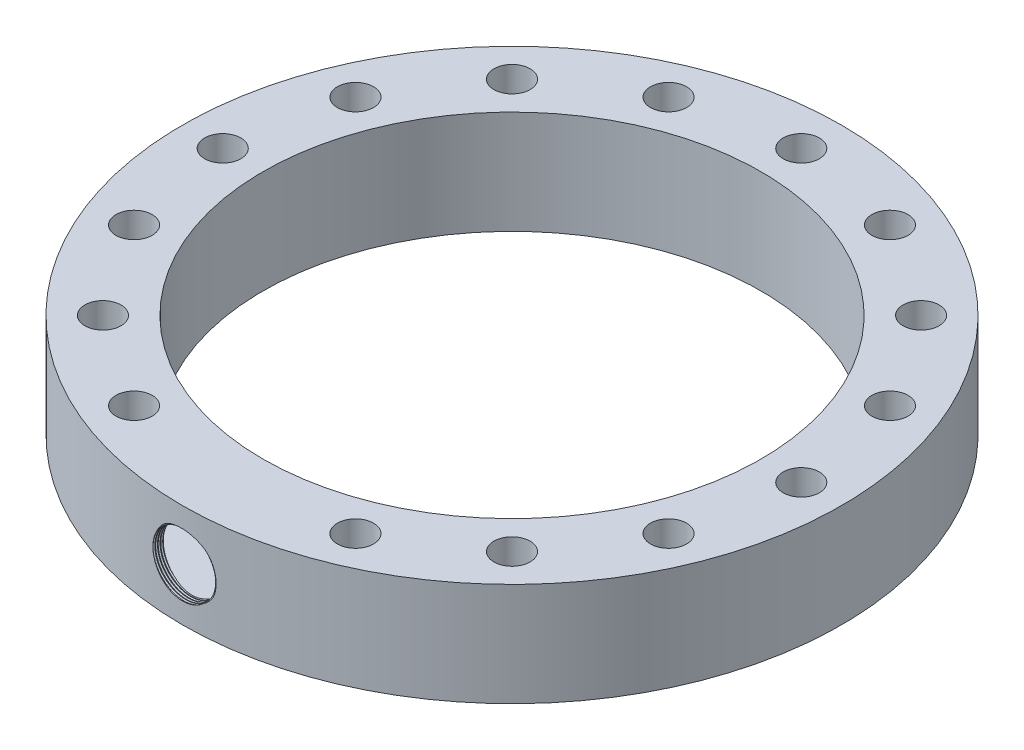
from build123d import *

# Parameters (mm, degrees)
SKETCH2_R           = 31.9
SKETCH2_R_2         = 24.1
BOSS_EXTRUDE1_DEPTH = 5
CUT_EXTRUDE1_START  = 27
SKETCH3_R           = 3
CUT_EXTRUDE1_DEPTH  = 40
SKETCH4_W           = 5.600902582
SKETCH4_H           = 8
THREAD1_PITCH       = 0.25
SKETCH5_R           = 2.25
SKETCH5_R_2         = 1.75
BOSS_EXTRUDE2_DEPTH = 10
SKETCH7_R           = 0.5
SKETCH8_R           = 1.75
CUT_EXTRUDE2_DEPTH  = 47.208440947


with BuildPart() as part:
    # Sketch2 → Boss-Extrude1 (new, symmetric)
    with BuildSketch(Plane(origin=(0, 0, 0), x_dir=(1, 0, 0), z_dir=(0, 1, 0))):
        with Locations(Location((0, 0, 0), (0, 0, 270))):
            Circle(SKETCH2_R)
        with Locations(Location((0, 0, 0), (0, 0, 270))):
            Circle(SKETCH2_R_2, mode=Mode.SUBTRACT)
    extrude(amount=BOSS_EXTRUDE1_DEPTH, both=True)

    # Sketch3 → Cut-Extrude1 (cut)
    with BuildSketch(Plane.XY.offset(CUT_EXTRUDE1_START)):
        with Locations(Location((0, 0, 0), (0, 0, 180))):
            Circle(SKETCH3_R)
    extrude(amount=CUT_EXTRUDE1_DEPTH, mode=Mode.SUBTRACT)

    # Sketch4 → Cut-Revolve1 (revolve, cut)
    with BuildSketch(Plane(origin=(0, 0, 0), x_dir=(0, 0, -1), z_dir=(1, 0, 0)), mode=Mode.PRIVATE) as cut_revolve1_sk:
        with Locations((-28.1, 0)):
            Rectangle(SKETCH4_W, SKETCH4_H)
    revolve(cut_revolve1_sk.sketch.rotate(Axis((0, -1000, 0), (0, 1, 0)), 180), axis=Axis((0, -1000, 0), (0, 1, 0)), mode=Mode.SUBTRACT)

    # Thread1: the profile of Thread Profile1 profile screwed along a right-hand helix of 12 turns, 6 arcs to a turn; built about Z, then put on its axis
    thread1_z = Axis((0, 0, 0), (0, 0, 1))
    thread1_corners = [(2.9997, 0, -0.000173205), (3.135316469, 0, 0.078125), (3.135316469, 0, 0.109375), (2.9997, 0, 0.187673204)]
    with BuildLine(mode=Mode.PRIVATE) as thread1_profile:
        Line(thread1_corners[0], thread1_corners[1])
        Line(thread1_corners[1], thread1_corners[2])
        Line(thread1_corners[2], thread1_corners[3])
        Line(thread1_corners[3], thread1_corners[0])
    thread1_cap = Face(thread1_profile.wire())
    thread1_turn_angles = [0, 30, 60, 90, 120, 150, 180, 210, 240, 270, 300, 330, 360]
    thread1_turn_weights = [1, 0.8660254037844387, 1, 0.8660254037844387, 1, 0.8660254037844387, 1, 0.8660254037844387, 1, 0.8660254037844387, 1, 0.8660254037844387, 1]
    thread1_turn_rails = [Edge.make_bspline([Vector(p[0], p[1], 0).rotate(thread1_z, thread1_turn_angles[k]) / thread1_turn_weights[k] + Vector(0, 0, p[2] + THREAD1_PITCH * thread1_turn_angles[k] / 360) for k in range(13)], [0, 0, 0, 1, 1, 2, 2, 3, 3, 4, 4, 5, 5, 6, 6, 6], 2, thread1_turn_weights) for p in thread1_corners]
    thread1_turn_sides = [Face.make_surface_from_curves(thread1_turn_rails[p[0]], thread1_turn_rails[p[1]]) for p in [(0, 1), (1, 2), (2, 3), (3, 0)]]
    thread1 = Plane(origin=(0, 0, 32), x_dir=(-1, 0, 0), z_dir=(0, 0, -1)) * Solid(Shell([*[p.moved(Location((0, 0, THREAD1_PITCH * i))) for i in range(12) for p in thread1_turn_sides], thread1_cap, thread1_cap.rotate(thread1_z, 4320).moved(Location((0, 0, THREAD1_PITCH * 4320 / 360)))]))
    add(thread1, mode=Mode.SUBTRACT)

    # Sketch5 → Boss-Extrude2 (add)
    # profile 1 of 15: a face of its own
    with BuildSketch(Plane(origin=(0, 5, 0), x_dir=(1, 0, 0), z_dir=(0, 1, 0))):
        with Locations(Location((0, 28, 0), (0, 0, 270))):
            Circle(SKETCH5_R)
        with Locations(Location((0, 28, 0), (0, 0, 270))):
            Circle(SKETCH5_R_2, mode=Mode.SUBTRACT)
    # profile 2 of 15: a face of its own
    with BuildSketch(Plane(origin=(0, 5, 0), x_dir=(1, 0, 0), z_dir=(0, 1, 0))):
        with Locations(Location((10.715136106, 25.86862691, 0), (0, 0, 270))):
            Circle(SKETCH5_R)
        with Locations(Location((10.715136106, 25.86862691, 0), (0, 0, 270))):
            Circle(SKETCH5_R_2, mode=Mode.SUBTRACT)
    # profile 3 of 15: a face of its own
    with BuildSketch(Plane(origin=(0, 5, 0), x_dir=(1, 0, 0), z_dir=(0, 1, 0))):
        with Locations(Location((19.798989873, 19.798989873, 0), (0, 0, 270))):
            Circle(SKETCH5_R)
        with Locations(Location((19.798989873, 19.798989873, 0), (0, 0, 270))):
            Circle(SKETCH5_R_2, mode=Mode.SUBTRACT)
    # profile 4 of 15: a face of its own
    with BuildSketch(Plane(origin=(0, 5, 0), x_dir=(1, 0, 0), z_dir=(0, 1, 0))):
        with Locations(Location((25.86862691, 10.715136106, 0), (0, 0, 270))):
            Circle(SKETCH5_R)
        with Locations(Location((25.86862691, 10.715136106, 0), (0, 0, 270))):
            Circle(SKETCH5_R_2, mode=Mode.SUBTRACT)
    # profile 5 of 15: a face of its own
    with BuildSketch(Plane(origin=(0, 5, 0), x_dir=(1, 0, 0), z_dir=(0, 1, 0))):
        with Locations(Location((28, 0, 0), (0, 0, 270))):
            Circle(SKETCH5_R)
        with Locations(Location((28, 0, 0), (0, 0, 270))):
            Circle(SKETCH5_R_2, mode=Mode.SUBTRACT)
    # profile 6 of 15: a face of its own
    with BuildSketch(Plane(origin=(0, 5, 0), x_dir=(1, 0, 0), z_dir=(0, 1, 0))):
        with Locations(Location((25.86862691, -10.715136106, 0), (0, 0, 270))):
            Circle(SKETCH5_R)
        with Locations(Location((25.86862691, -10.715136106, 0), (0, 0, 270))):
            Circle(SKETCH5_R_2, mode=Mode.SUBTRACT)
    # profile 7 of 15: a face of its own
    with BuildSketch(Plane(origin=(0, 5, 0), x_dir=(1, 0, 0), z_dir=(0, 1, 0))):
        with Locations(Location((19.798989873, -19.798989873, 0), (0, 0, 270))):
            Circle(SKETCH5_R)
        with Locations(Location((19.798989873, -19.798989873, 0), (0, 0, 270))):
            Circle(SKETCH5_R_2, mode=Mode.SUBTRACT)
    # profile 8 of 15: a face of its own
    with BuildSketch(Plane(origin=(0, 5, 0), x_dir=(1, 0, 0), z_dir=(0, 1, 0))):
        with Locations(Location((10.715136106, -25.86862691, 0), (0, 0, 270))):
            Circle(SKETCH5_R)
        with Locations(Location((10.715136106, -25.86862691, 0), (0, 0, 270))):
            Circle(SKETCH5_R_2, mode=Mode.SUBTRACT)
    # profile 9 of 15: a face of its own
    with BuildSketch(Plane(origin=(0, 5, 0), x_dir=(1, 0, 0), z_dir=(0, 1, 0))):
        with Locations(Location((-10.715136106, -25.86862691, 0), (0, 0, 270))):
            Circle(SKETCH5_R)
        with Locations(Location((-10.715136106, -25.86862691, 0), (0, 0, 270))):
            Circle(SKETCH5_R_2, mode=Mode.SUBTRACT)
    # profile 10 of 15: a face of its own
    with BuildSketch(Plane(origin=(0, 5, 0), x_dir=(1, 0, 0), z_dir=(0, 1, 0))):
        with Locations(Location((-19.798989873, -19.798989873, 0), (0, 0, 270))):
            Circle(SKETCH5_R)
        with Locations(Location((-19.798989873, -19.798989873, 0), (0, 0, 270))):
            Circle(SKETCH5_R_2, mode=Mode.SUBTRACT)
    # profile 11 of 15: a face of its own
    with BuildSketch(Plane(origin=(0, 5, 0), x_dir=(1, 0, 0), z_dir=(0, 1, 0))):
        with Locations(Location((-25.86862691, -10.715136106, 0), (0, 0, 270))):
            Circle(SKETCH5_R)
        with Locations(Location((-25.86862691, -10.715136106, 0), (0, 0, 270))):
            Circle(SKETCH5_R_2, mode=Mode.SUBTRACT)
    # profile 12 of 15: a face of its own
    with BuildSketch(Plane(origin=(0, 5, 0), x_dir=(1, 0, 0), z_dir=(0, 1, 0))):
        with Locations(Location((-28, 0, 0), (0, 0, 270))):
            Circle(SKETCH5_R)
        with Locations(Location((-28, 0, 0), (0, 0, 270))):
            Circle(SKETCH5_R_2, mode=Mode.SUBTRACT)
    # profile 13 of 15: a face of its own
    with BuildSketch(Plane(origin=(0, 5, 0), x_dir=(1, 0, 0), z_dir=(0, 1, 0))):
        with Locations(Location((-25.86862691, 10.715136106, 0), (0, 0, 270))):
            Circle(SKETCH5_R)
        with Locations(Location((-25.86862691, 10.715136106, 0), (0, 0, 270))):
            Circle(SKETCH5_R_2, mode=Mode.SUBTRACT)
    # profile 14 of 15: a face of its own
    with BuildSketch(Plane(origin=(0, 5, 0), x_dir=(1, 0, 0), z_dir=(0, 1, 0))):
        with Locations(Location((-19.798989873, 19.798989873, 0), (0, 0, 270))):
            Circle(SKETCH5_R)
        with Locations(Location((-19.798989873, 19.798989873, 0), (0, 0, 270))):
            Circle(SKETCH5_R_2, mode=Mode.SUBTRACT)
    # profile 15 of 15: a face of its own
    with BuildSketch(Plane(origin=(0, 5, 0), x_dir=(1, 0, 0), z_dir=(0, 1, 0))):
        with Locations(Location((-10.715136106, 25.86862691, 0), (0, 0, 270))):
            Circle(SKETCH5_R)
        with Locations(Location((-10.715136106, 25.86862691, 0), (0, 0, 270))):
            Circle(SKETCH5_R_2, mode=Mode.SUBTRACT)
    extrude(amount=-BOSS_EXTRUDE2_DEPTH)

    # Sketch7 → Cut-Revolve2 (revolve, cut)
    with BuildSketch(Plane(origin=(0, 0, 0), x_dir=(0, 0, -1), z_dir=(1, 0, 0))):
        with Locations((-28.101683522, 0)):
            Circle(SKETCH7_R)
    revolve(axis=Axis((0, -1000, 0), (0, 1, 0)), mode=Mode.SUBTRACT)

    # Sketch8 → Cut-Extrude2 (cut, through all)
    with BuildSketch(Plane(origin=(0, 5, 0), x_dir=(1, 0, 0), z_dir=(0, 1, 0))):
        with Locations(Location((0, 28, 0), (0, 0, 270))):
            Circle(SKETCH8_R)
        with Locations(Location((10.715136106, 25.86862691, 0), (0, 0, 270))):
            Circle(SKETCH8_R)
        with Locations(Location((19.798989873, 19.798989873, 0), (0, 0, 270))):
            Circle(SKETCH8_R)
        with Locations(Location((25.86862691, 10.715136106, 0), (0, 0, 270))):
            Circle(SKETCH8_R)
        with Locations(Location((28, 0, 0), (0, 0, 270))):
            Circle(SKETCH8_R)
        with Locations(Location((25.86862691, -10.715136106, 0), (0, 0, 270))):
            Circle(SKETCH8_R)
        with Locations(Location((19.798989873, -19.798989873, 0), (0, 0, 270))):
            Circle(SKETCH8_R)
        with Locations(Location((10.715136106, -25.86862691, 0), (0, 0, 270))):
            Circle(SKETCH8_R)
        with Locations(Location((-10.715136106, -25.86862691, 0), (0, 0, 270))):
            Circle(SKETCH8_R)
        with Locations(Location((-19.798989873, -19.798989873, 0), (0, 0, 270))):
            Circle(SKETCH8_R)
        with Locations(Location((-25.86862691, -10.715136106, 0), (0, 0, 270))):
            Circle(SKETCH8_R)
        with Locations(Location((-28, 0, 0), (0, 0, 270))):
            Circle(SKETCH8_R)
        with Locations(Location((-25.86862691, 10.715136106, 0), (0, 0, 270))):
            Circle(SKETCH8_R)
        with Locations(Location((-19.798989873, 19.798989873, 0), (0, 0, 270))):
            Circle(SKETCH8_R)
        with Locations(Location((-10.715136106, 25.86862691, 0), (0, 0, 270))):
            Circle(SKETCH8_R)
    extrude(amount=-CUT_EXTRUDE2_DEPTH, mode=Mode.SUBTRACT)


solid = part.part
